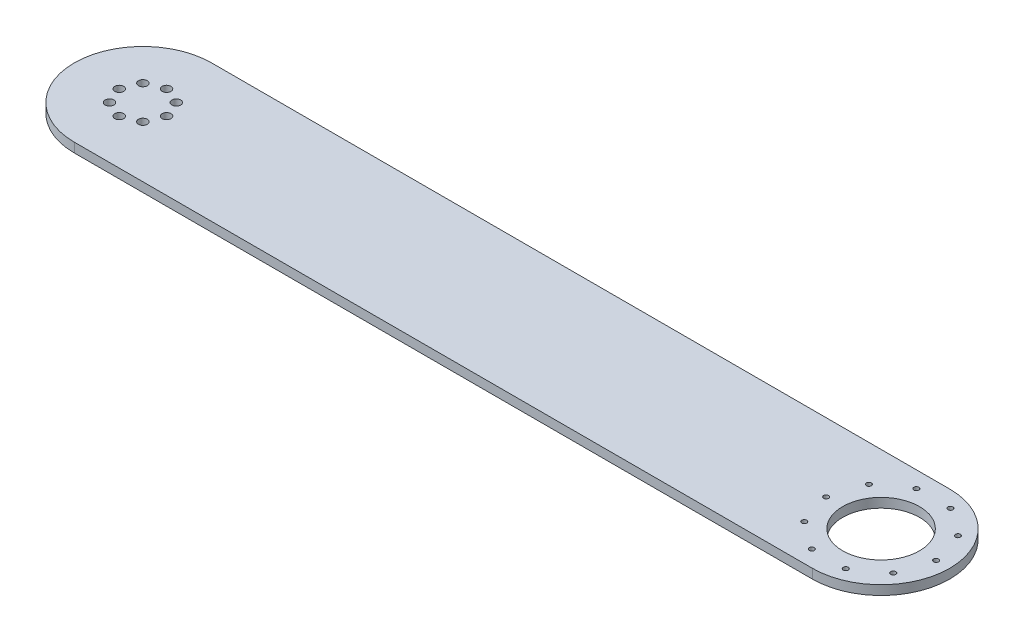
from build123d import *

# Parameters (mm, degrees)
SKETCH1_R           = 3
SKETCH1_R_2         = 1.7
SKETCH1_R_3         = 26
BOSS_EXTRUDE1_DEPTH = 6.35


with BuildPart() as part:
    # Sketch1 → Boss-Extrude1 (new body)
    with BuildSketch(Plane(origin=(0, 0, 0), x_dir=(1, 0, 0), z_dir=(0, 1, 0))):
        with BuildLine():
            Line((500, 46.5), (0, 46.5))
            ThreePointArc((0, 46.5), (-46.5, 0), (0, -46.5))
            Line((0, -46.5), (500, -46.5))
            ThreePointArc((500, -46.5), (546.5, 0), (500, 46.5))
        make_face()
        with Locations((0, -16)):
            Circle(SKETCH1_R, mode=Mode.SUBTRACT)
        with Locations((-11.313708499, -11.313708499)):
            Circle(SKETCH1_R, mode=Mode.SUBTRACT)
        with Locations((11.313708499, -11.313708499)):
            Circle(SKETCH1_R, mode=Mode.SUBTRACT)
        with Locations((16, 0)):
            Circle(SKETCH1_R, mode=Mode.SUBTRACT)
        with Locations((488.48911696, -35.426855232)):
            Circle(SKETCH1_R_2, mode=Mode.SUBTRACT)
        with Locations((511.51088304, -35.426855232)):
            Circle(SKETCH1_R_2, mode=Mode.SUBTRACT)
        with Locations((469.86411696, -21.895000648)):
            Circle(SKETCH1_R_2, mode=Mode.SUBTRACT)
        with Locations((530.13588304, -21.895000648)):
            Circle(SKETCH1_R_2, mode=Mode.SUBTRACT)
        with Locations((462.75, 0)):
            Circle(SKETCH1_R_2, mode=Mode.SUBTRACT)
        with Locations((-16, 0)):
            Circle(SKETCH1_R, mode=Mode.SUBTRACT)
        with Locations((-11.313708499, 11.313708499)):
            Circle(SKETCH1_R, mode=Mode.SUBTRACT)
        with Locations((11.313708499, 11.313708499)):
            Circle(SKETCH1_R, mode=Mode.SUBTRACT)
        with Locations((0, 16)):
            Circle(SKETCH1_R, mode=Mode.SUBTRACT)
        with Locations((500, 0)):
            Circle(SKETCH1_R_3, mode=Mode.SUBTRACT)
        with Locations((537.25, 0)):
            Circle(SKETCH1_R_2, mode=Mode.SUBTRACT)
        with Locations((469.86411696, 21.895000648)):
            Circle(SKETCH1_R_2, mode=Mode.SUBTRACT)
        with Locations((530.13588304, 21.895000648)):
            Circle(SKETCH1_R_2, mode=Mode.SUBTRACT)
        with Locations((488.48911696, 35.426855232)):
            Circle(SKETCH1_R_2, mode=Mode.SUBTRACT)
        with Locations((511.51088304, 35.426855232)):
            Circle(SKETCH1_R_2, mode=Mode.SUBTRACT)
    extrude(amount=BOSS_EXTRUDE1_DEPTH)


solid = part.part
